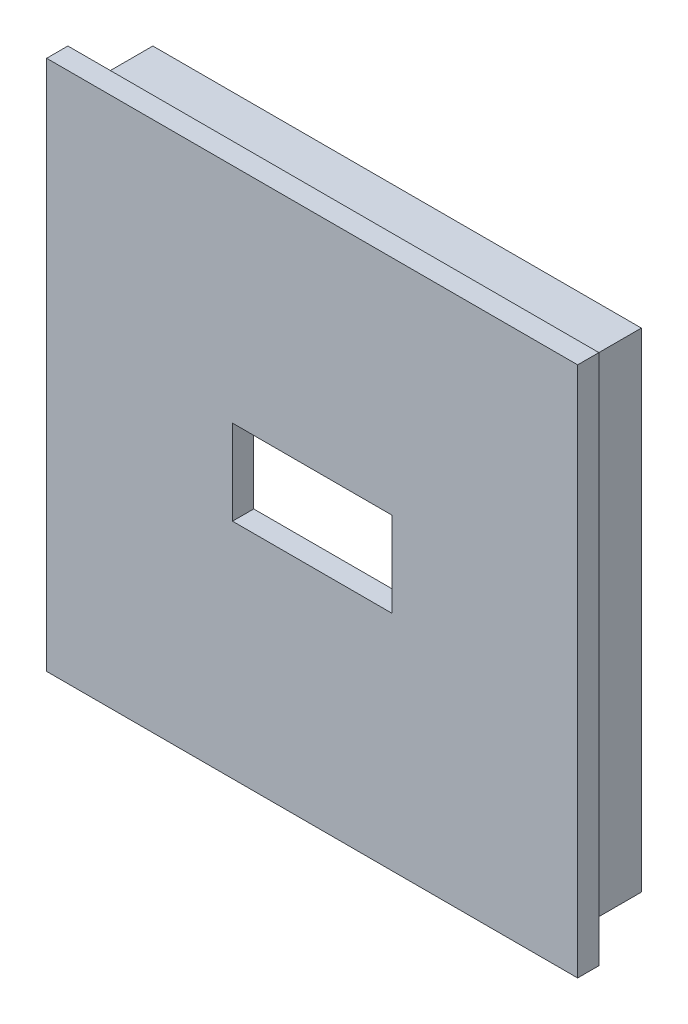
from build123d import *

# Parameters (mm, degrees)
SKETCH1_W           = 25
SKETCH1_H           = 25
BOSS_EXTRUDE1_DEPTH = 1
SKETCH2_W           = 23
SKETCH2_H           = 23
BOSS_EXTRUDE2_DEPTH = 3
SHELL1_START        = -3
SHELL1_OUTLINE_W    = 21
SHELL1_OUTLINE_H    = 21
SHELL1_DEPTH        = 3
SKETCH3_W           = 7.5
SKETCH3_H           = 4
CUT_EXTRUDE1_DEPTH  = 10


# Read off the part's stored shape, not the designer's step: Shell1
with BuildPart() as part:
    # Sketch1 → Boss-Extrude1 (new body)
    with BuildSketch(Plane.XY):
        Rectangle(SKETCH1_W, SKETCH1_H)
    extrude(amount=BOSS_EXTRUDE1_DEPTH)

    # Sketch2 → Boss-Extrude2 (add)
    with BuildSketch(Plane(origin=(0, 0, 0), x_dir=(-1, 0, 0), z_dir=(0, 0, -1))):
        Rectangle(SKETCH2_W, SKETCH2_H)
    extrude(amount=BOSS_EXTRUDE2_DEPTH)

    # Shell1 outline → Shell1 (cut)
    with BuildSketch(Plane.XY.offset(SHELL1_START)):
        Rectangle(SHELL1_OUTLINE_W, SHELL1_OUTLINE_H)
    extrude(amount=SHELL1_DEPTH, mode=Mode.SUBTRACT)

    # Sketch3 → Cut-Extrude1 (cut)
    with BuildSketch(Plane(origin=(0, 0, 0), x_dir=(-1, 0, 0), z_dir=(0, 0, -1))):
        Rectangle(SKETCH3_W, SKETCH3_H)
    extrude(amount=-CUT_EXTRUDE1_DEPTH, mode=Mode.SUBTRACT)


solid = part.part
